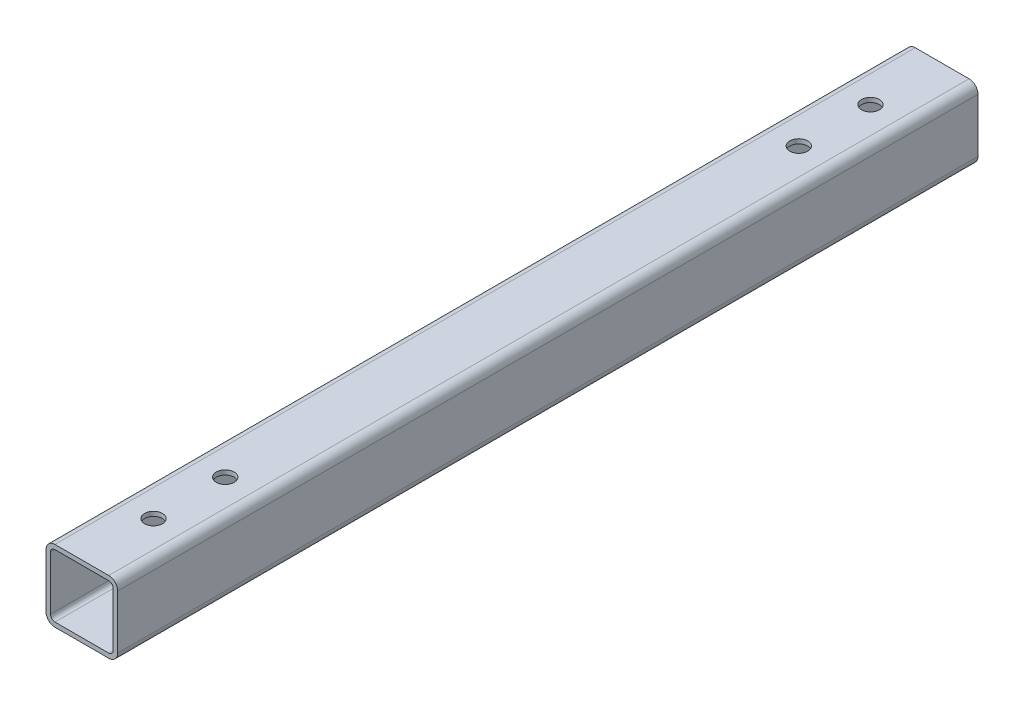
from build123d import *

# Parameters (mm, degrees)
SKETCH1_W          = 25.4
SKETCH1_H          = 25.4
BASE_EXTRUDE_DEPTH = 152.4
FILLET1_R          = 3.175
SHELL1_T           = -1.5875
SKETCH5_R          = 3.175
CUT_EXTRUDE2_DEPTH = 156.02325632


with BuildPart() as part:
    # Sketch1 → Base-Extrude (new, symmetric)
    with BuildSketch(Plane.XY):
        Rectangle(SKETCH1_W, SKETCH1_H)
    extrude(amount=BASE_EXTRUDE_DEPTH, both=True)

    # Fillet1
    fillet1_edges = [part.edges().sort_by_distance(p)[0] for p in [
        (-12.7, 12.7, 0),
        (-12.7, -12.7, 0),
        (12.7, 12.7, 0),
        (12.7, -12.7, 0),
    ]]
    fillet(fillet1_edges, radius=FILLET1_R)

    # Shell1
    shell1_openings = [part.faces().sort_by_distance(p)[0] for p in [
        (0, 0, -152.4),
        (0, 0, 152.4),
    ]]
    offset(amount=SHELL1_T, openings=shell1_openings, kind=Kind.INTERSECTION)

    # Sketch5 → Cut-Extrude2 (cut, through all)
    with BuildSketch(Plane.XZ.offset(12.7)):
        with Locations((0, 127)):
            Circle(SKETCH5_R)
        with Locations((0, 101.6)):
            Circle(SKETCH5_R)
        with Locations((0, -127)):
            Circle(SKETCH5_R)
        with Locations((0, -101.6)):
            Circle(SKETCH5_R)
    extrude(amount=-CUT_EXTRUDE2_DEPTH, mode=Mode.SUBTRACT)


solid = part.part
